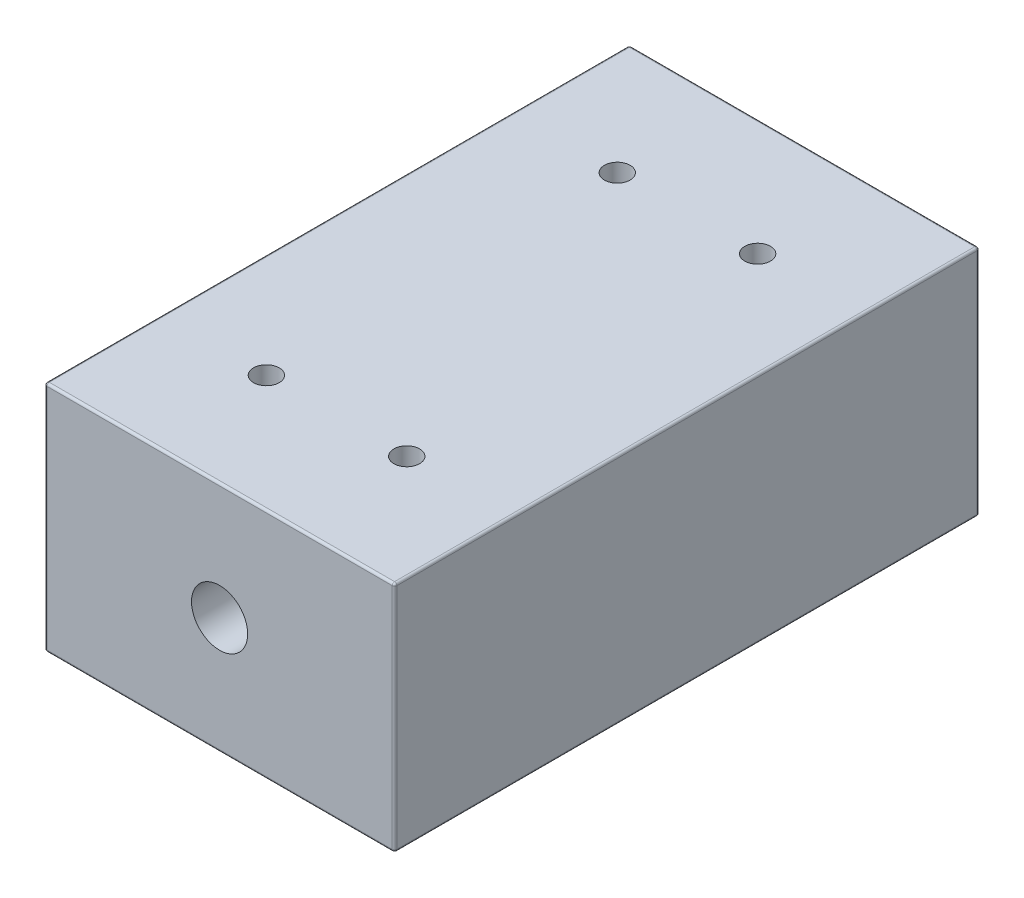
from build123d import *

# Parameters (mm, degrees)
SKETCH1_W                        = 74.8
SKETCH1_H                        = 49.8
SLIDER_BODY_DEPTH                = 125
SKETCH2_R                        = 11
LEAD_NUT_INSET_DEPTH             = 15
SKETCH3_R                        = 6
LEADSCREW_CLEARANCE_DEPTH        = 143.039008726
CORNER_BREAK_R                   = 0.5
BOLT_CLEARANCE_HOLES_D           = 5.5
SKETCH7_R                        = 6
NUT_CLEARANCE_COUNTERBORES_DEPTH = 10


with BuildPart() as part:
    # Sketch1 → slider body (new body)
    with BuildSketch(Plane.XY):
        with Locations((37.4, 24.9)):
            Rectangle(SKETCH1_W, SKETCH1_H)
    extrude(amount=SLIDER_BODY_DEPTH)

    # Sketch2 → lead nut inset (cut)
    with BuildSketch(Plane(origin=(0, 0, 0), x_dir=(-1, 0, 0), z_dir=(0, 0, -1))):
        with Locations((-37.4, 24.9)):
            Circle(SKETCH2_R)
    extrude(amount=-LEAD_NUT_INSET_DEPTH, mode=Mode.SUBTRACT)

    # Sketch3 → leadscrew clearance (cut, through all)
    with BuildSketch(Plane(origin=(0, 0, 15), x_dir=(-1, 0, 0), z_dir=(0, 0, -1))):
        with Locations((-37.4, 24.9)):
            Circle(SKETCH3_R)
    extrude(amount=-LEADSCREW_CLEARANCE_DEPTH, mode=Mode.SUBTRACT)

    # corner break
    corner_break_edges = [part.edges().sort_by_distance(p)[0] for p in [
        (0, 24.9, 125),
        (0, 24.9, 0),
        (0, 0, 62.5),
        (37.4, 0, 125),
        (37.4, 0, 0),
        (74.8, 0, 62.5),
        (74.8, 24.9, 125),
        (74.8, 24.9, 0),
        (74.8, 49.8, 62.5),
        (37.4, 49.8, 125),
        (0, 49.8, 62.5),
        (37.4, 49.8, 0),
    ]]
    fillet(corner_break_edges, radius=CORNER_BREAK_R)

    # bolt clearance holes (through all)
    with Locations(Plane(origin=(0, 49.8, 0), x_dir=(1, 0, 0), z_dir=(0, 1, 0))):
        with Locations((52.4, -100), (22.4, -25), (52.4, -25), (22.4, -100)):
            Hole(BOLT_CLEARANCE_HOLES_D / 2)

    # Sketch7 → nut clearance counterbores (cut)
    with BuildSketch(Plane.XZ):
        with Locations((22.4, 100)):
            Circle(SKETCH7_R)
        with Locations((52.4, 100)):
            Circle(SKETCH7_R)
        with Locations((52.4, 25)):
            Circle(SKETCH7_R)
        with Locations((22.4, 25)):
            Circle(SKETCH7_R)
    extrude(amount=-NUT_CLEARANCE_COUNTERBORES_DEPTH, mode=Mode.SUBTRACT)


solid = part.part
